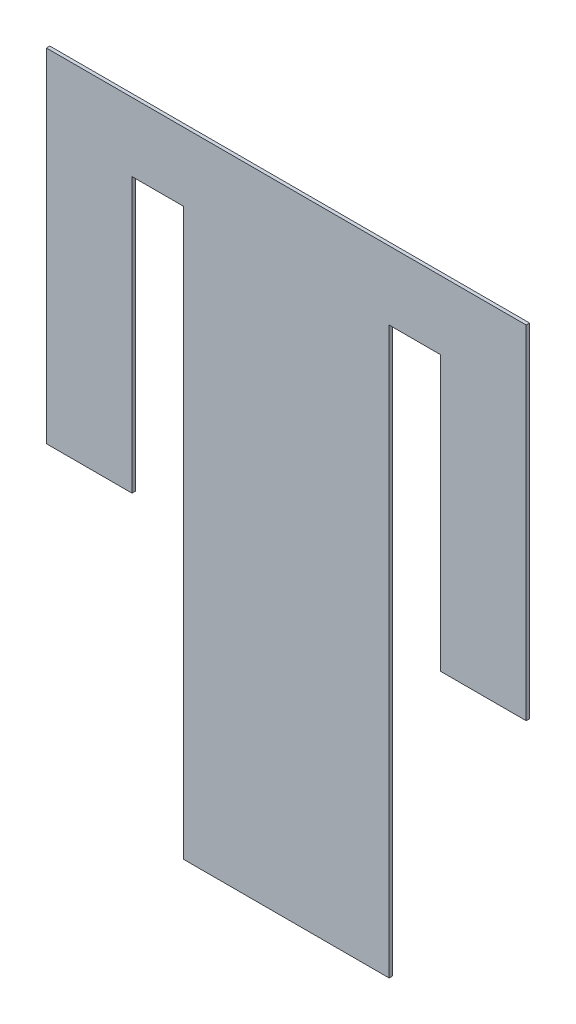
from build123d import *

# Parameters (mm, degrees)
BOSS_EXTRUDE1_DEPTH = 2


with BuildPart() as part:
    # Sketch1 → Boss-Extrude1 (new body)
    with BuildSketch(Plane.XY):
        Polygon((0, 0), (0, 200), (280, 200), (280, 0), (230, 0), (230, 160), (200, 160), (200, -170), (80, -170), (80, 160), (50, 160), (50, 0), align=None)
    extrude(amount=BOSS_EXTRUDE1_DEPTH)


solid = part.part
